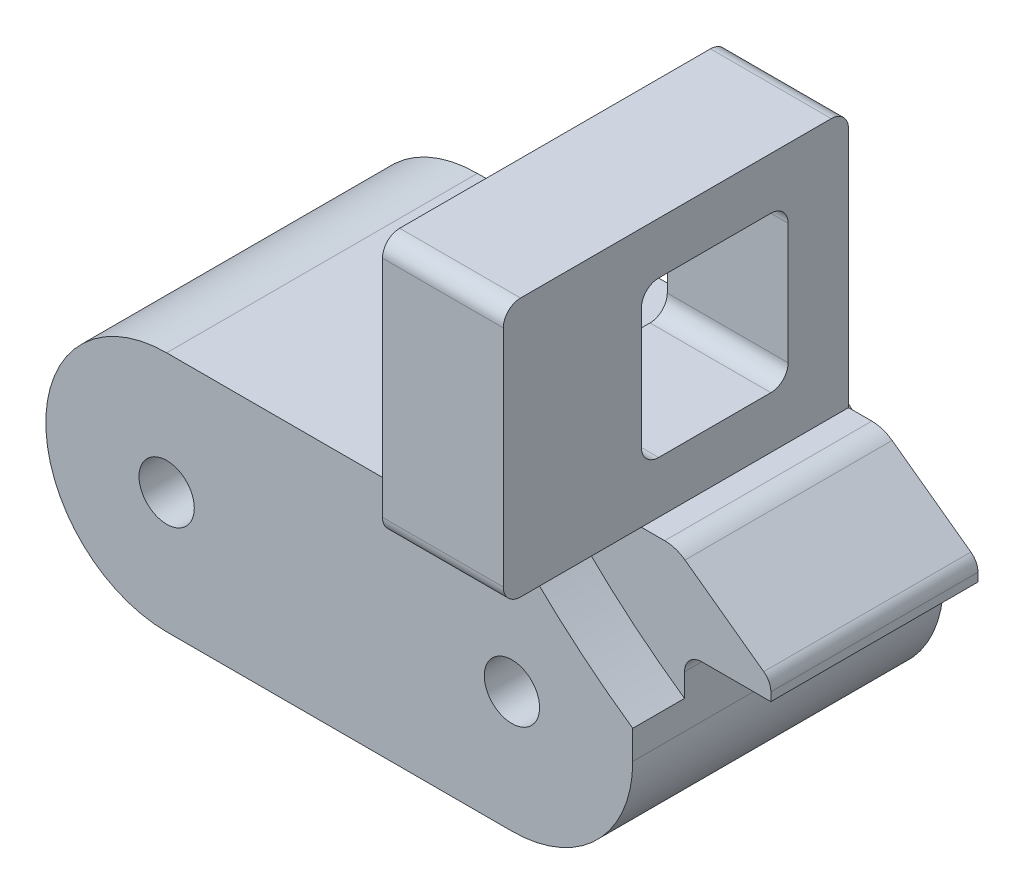
from build123d import *
from build123d.topology import SkipClean

# Parameters (mm, degrees)
SKETCH_1_R          = 7
SKETCH_1_R_2        = 1.6
EXTRUDE_1_DEPTH     = 14
FILLET_2_R          = 1
FILLET_4_R          = 2
FILLET_5_R          = 1
CUT_EXTRUDE_1_DEPTH = 10
SKETCH_4_R          = 43
SKETCH_4_W          = 56
SKETCH_4_H          = 56
CUT_EXTRUDE_2_DEPTH = 2
SKETCH_5_R          = 1.6
EXTRUDE_3_DEPTH     = 2
EXTRUDE_START       = 2
SKETCH_6_R          = 1.6
EXTRUDE_4_DEPTH     = 2
EXTRUDE_START_2     = 1
EXTRUDE_6_DEPTH     = 1
EXTRUDE_7_DEPTH     = 1
EXTRUDE_8_DEPTH     = 8
CUT_EXTRUDE_3_DEPTH = 45.127655727
FILLET_6_R          = 1
EXTRUDE_10_DEPTH    = 1


with BuildPart() as part:
    # 草图1 → 凸台-拉伸1 (new body)
    # profile 1 of 3: a face of its own
    with BuildSketch(Plane.XY):
        with BuildLine():
            Line((-2.5, 7), (-20, 7))
            ThreePointArc((-20, 7), (-15.050252532, 4.949747468), (-13, 0))
            ThreePointArc((-13, 0), (-15.050252532, -4.949747468), (-20, -7))
            Line((-20, -7), (0, -7))
            ThreePointArc((0, -7), (-4.949747468, 4.949747468), (7, 0))
            Line((7, 0), (7, 4))
            Line((7, 4), (12, 4))
            Line((12, 4), (12, 5))
            Line((12, 5), (6.5, 9))
            Line((6.5, 9), (3.5, 9))
            Line((3.5, 9), (3.5, 26))
            Line((3.5, 26), (-2.5, 26))
            Line((-2.5, 26), (-2.5, 7))
        make_face()
    # profile 2 of 3: a face of its own
    with BuildSketch(Plane.XY):
        Circle(SKETCH_1_R)
        Circle(SKETCH_1_R_2, mode=Mode.SUBTRACT)
    # profile 3 of 3: a face of its own
    with BuildSketch(Plane.XY):
        with Locations((-20, 0)):
            Circle(SKETCH_1_R)
        with Locations((-20, 0)):
            Circle(SKETCH_1_R_2, mode=Mode.SUBTRACT)
    extrude(amount=EXTRUDE_1_DEPTH)

    # 圆角2
    fillet_2_edges = [part.edges().sort_by_distance(p)[0] for p in [
        (-2.5, 7, 7),
        (7, 4, 7),
    ]]
    fillet(fillet_2_edges, radius=FILLET_2_R)

    # 圆角4
    fillet_4_edges = [part.edges().sort_by_distance(p)[0] for p in [
        (6.5, 9, 7),
    ]]
    fillet(fillet_4_edges, radius=FILLET_4_R)

    # 圆角5
    fillet_5_edges = [part.edges().sort_by_distance(p)[0] for p in [
        (12, 5, 7),
    ]]
    fillet(fillet_5_edges, radius=FILLET_5_R)

    # 草图2 → 切除-拉伸1 (cut)
    with BuildSketch(Plane(origin=(3.5, 0, 0), x_dir=(0, 0, -1), z_dir=(1, 0, 0))):
        Polygon((-12, 9), (-14, 9), (-14, 26), (0, 26), (0, 9), (-2, 9), (-2, 24), (-12, 24), align=None)
    extrude(amount=-CUT_EXTRUDE_1_DEPTH, mode=Mode.SUBTRACT)

    # 草图4 → 切除-拉伸2 (cut)
    with BuildSketch(Plane.XY.offset(14)):
        with Locations((31.5, 37)):
            Circle(SKETCH_4_R)
        with Locations((31.5, 37)):
            Rectangle(SKETCH_4_W, SKETCH_4_H, mode=Mode.SUBTRACT)
    cut_extrude_2 = extrude(amount=-CUT_EXTRUDE_2_DEPTH, mode=Mode.SUBTRACT)

    # 镜向1: 切除-拉伸2 across plane
    add(cut_extrude_2.mirror(Plane.XY.offset(7)), mode=Mode.SUBTRACT)

    # 草图5 → 凸台-拉伸3 (add)
    with SkipClean():  # the faces are left unmerged after this step: merging them gives an invalid solid
        with BuildSketch(Plane.XY.offset(14)):
            with BuildLine():
                Line((-1.134337744, 9), (-2.5, 9))
                Line((-2.5, 9), (-2.5, 8))
                ThreePointArc((-2.5, 8), (-2.792893219, 7.292893219), (-3.5, 7))
                Line((-3.5, 7), (-20, 7))
                ThreePointArc((-20, 7), (-27, 0), (-20, -7))
                Line((-20, -7), (0, -7))
                ThreePointArc((0, -7), (4.949747468, -4.949747468), (7, 0))
                Line((7, 0), (7, 1.662343032))
                ThreePointArc((7, 1.662343032), (2.698204226, 5.071070168), (-1.134337744, 9))
            make_face()
            Circle(SKETCH_5_R, mode=Mode.SUBTRACT)
            with Locations((-20, 0)):
                Circle(SKETCH_5_R, mode=Mode.SUBTRACT)
        extrude(amount=EXTRUDE_3_DEPTH)

    # 草图6 → 凸台-拉伸4 (add)
    with SkipClean():  # the faces are left unmerged after this step: merging them gives an invalid solid
        with BuildSketch(Plane(origin=(0, 0, 0), x_dir=(-1, 0, 0), z_dir=(0, 0, -1)).offset(EXTRUDE_START)):
            with BuildLine():
                Line((-7, 1.662343032), (-7, 0))
                ThreePointArc((-7, 0), (-4.949747468, -4.949747468), (0, -7))
                Line((0, -7), (20, -7))
                ThreePointArc((20, -7), (27, 0), (20, 7))
                Line((20, 7), (3.5, 7))
                ThreePointArc((3.5, 7), (2.792893219, 7.292893219), (2.5, 8))
                Line((2.5, 8), (2.5, 9))
                Line((2.5, 9), (1.134337744, 9))
                ThreePointArc((1.134337744, 9), (-2.698204226, 5.071070168), (-7, 1.662343032))
            make_face()
            with Locations((20, 0)):
                Circle(SKETCH_6_R, mode=Mode.SUBTRACT)
            Circle(SKETCH_6_R, mode=Mode.SUBTRACT)
        extrude(amount=-EXTRUDE_4_DEPTH)

    # 草图8 → 凸台-拉伸6 (add)
    with SkipClean():  # the faces are left unmerged after this step: merging them gives an invalid solid
        with BuildSketch(Plane.XY.offset(12).offset(EXTRUDE_START_2)):
            with BuildLine():
                Line((-2.5, 9), (-1.134337744, 9))
                ThreePointArc((-1.134337744, 9), (2.698204226, 5.071070168), (7, 1.662343032))
                Line((7, 1.662343032), (7, 3))
                ThreePointArc((7, 3), (7.292893219, 3.707106781), (8, 4))
                Line((8, 4), (12, 4))
                Line((12, 4), (12, 4.490775408))
                ThreePointArc((12, 4.490775408), (11.891114947, 4.944553053), (11.588171698, 5.299511493))
                Line((11.588171698, 5.299511493), (7.025975768, 8.617472169))
                ThreePointArc((7.025975768, 8.617472169), (6.468120717, 8.901965344), (5.849632373, 9))
                Line((5.849632373, 9), (3.5, 9))
                Line((3.5, 9), (3.5, 24))
                Line((3.5, 24), (-2.5, 24))
                Line((-2.5, 24), (-2.5, 9))
            make_face()
        extrude(amount=-EXTRUDE_6_DEPTH)

    # 草图9 → 凸台-拉伸7 (add)
    with SkipClean():  # the faces are left unmerged after this step: merging them gives an invalid solid
        with BuildSketch(Plane(origin=(0, 0, 2), x_dir=(-1, 0, 0), z_dir=(0, 0, -1))):
            with BuildLine():
                Line((-3.5, 24), (-3.5, 9))
                Line((-3.5, 9), (-5.849632373, 9))
                ThreePointArc((-5.849632373, 9), (-6.468120717, 8.901965344), (-7.025975768, 8.617472169))
                Line((-7.025975768, 8.617472169), (-11.588171698, 5.299511493))
                ThreePointArc((-11.588171698, 5.299511493), (-11.891114947, 4.944553053), (-12, 4.490775408))
                Line((-12, 4.490775408), (-12, 4))
                Line((-12, 4), (-8, 4))
                ThreePointArc((-8, 4), (-7.292893219, 3.707106781), (-7, 3))
                Line((-7, 3), (-7, 1.662343032))
                ThreePointArc((-7, 1.662343032), (-2.698204226, 5.071070168), (1.134337744, 9))
                Line((1.134337744, 9), (2.5, 9))
                Line((2.5, 9), (2.5, 24))
                Line((2.5, 24), (-3.5, 24))
            make_face()
        extrude(amount=EXTRUDE_7_DEPTH)

    # 草图14 → 凸台-拉伸8 (add)
    with SkipClean():  # the faces are left unmerged after this step: merging them gives an invalid solid
        with BuildSketch(Plane.XY.offset(13)):
            Polygon((-1.134337744, 9), (3.5, 9), (3.5, 24), (-2.5, 24), (-2.5, 9), align=None)
        extrude(amount=EXTRUDE_8_DEPTH)

    # 草图13 → 切除-拉伸3 (cut, through all)
    with SkipClean():  # the faces are left unmerged after this step: merging them gives an invalid solid
        with BuildSketch(Plane(origin=(3.5, 0, 0), x_dir=(0, 0, -1), z_dir=(1, 0, 0))):
            with BuildLine():
                Line((-13, 20), (-13, 13))
                ThreePointArc((-13, 13), (-12.707106781, 12.292893219), (-12, 12))
                Line((-12, 12), (-5.5, 12))
                ThreePointArc((-5.5, 12), (-4.792893219, 12.292893219), (-4.5, 13))
                Line((-4.5, 13), (-4.5, 20))
                ThreePointArc((-4.5, 20), (-4.792893219, 20.707106781), (-5.5, 21))
                Line((-5.5, 21), (-12, 21))
                ThreePointArc((-12, 21), (-12.707106781, 20.707106781), (-13, 20))
            make_face()
        extrude(amount=-CUT_EXTRUDE_3_DEPTH, mode=Mode.SUBTRACT)

    # 圆角6
    fillet_6_edges = [part.edges().sort_by_distance(p)[0] for p in [
        (0.5, 24, 1),
        (0.5, 24, 21),
        (0.5, 9, 21),
    ]]
    fillet(fillet_6_edges, radius=FILLET_6_R - 0.0001)  # a hair under: the kernel refuses the full size

    # 草图16 → 凸台-拉伸10 (add)
    with SkipClean():  # the faces are left unmerged after this step: merging them gives an invalid solid
        with BuildSketch(Plane(origin=(3.5, 0, 0), x_dir=(0, 0, -1), z_dir=(1, 0, 0)).offset(EXTRUDE_START_2)):
            with BuildLine():
                Line((-1, 9), (-1, 23))
                ThreePointArc((-1, 23), (-1.292893219, 23.707106781), (-2, 24))
                Line((-2, 24), (-20, 24))
                ThreePointArc((-20, 24), (-20.707106781, 23.707106781), (-21, 23))
                Line((-21, 23), (-21, 10))
                ThreePointArc((-21, 10), (-20.707106781, 9.292893219), (-20, 9))
                Line((-20, 9), (-13, 9))
                Line((-13, 9), (-1, 9))
            make_face()
            with BuildLine():
                Line((-12, 12), (-5.5, 12))
                ThreePointArc((-5.5, 12), (-4.792893219, 12.292893219), (-4.5, 13))
                Line((-4.5, 13), (-4.5, 20))
                ThreePointArc((-4.5, 20), (-4.792893219, 20.707106781), (-5.5, 21))
                Line((-5.5, 21), (-12, 21))
                ThreePointArc((-12, 21), (-12.707106781, 20.707106781), (-13, 20))
                Line((-13, 20), (-13, 13))
                ThreePointArc((-13, 13), (-12.707106781, 12.292893219), (-12, 12))
            make_face(mode=Mode.SUBTRACT)
        extrude(amount=-EXTRUDE_10_DEPTH)


solid = part.part
